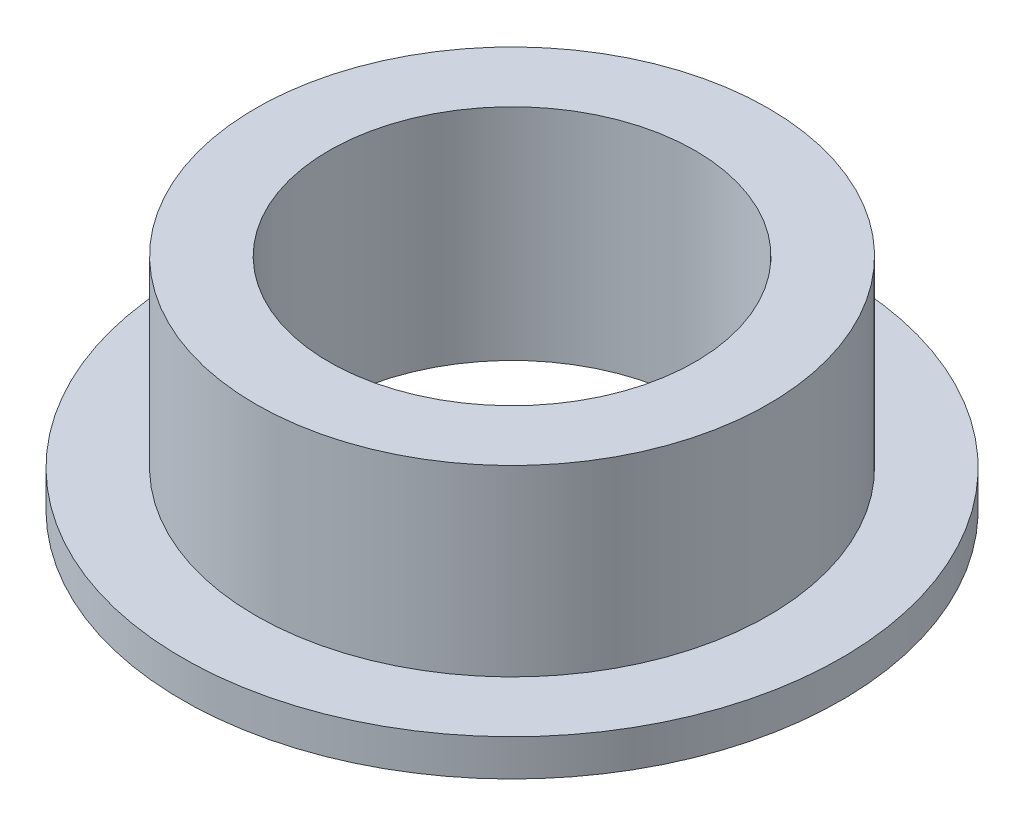
from build123d import *

# Parameters (mm, degrees)
SKETCH1_R           = 11.1125
SKETCH1_R_2         = 7.9375
BOSS_EXTRUDE1_DEPTH = 4.7625
BOSS_EXTRUDE2_START = -1.5875
SKETCH2_R           = 14.2875
SKETCH2_R_2         = 11.1125
BOSS_EXTRUDE2_DEPTH = 1.5875


with BuildPart() as part:
    # Sketch1 → Boss-Extrude1 (new, symmetric)
    with BuildSketch(Plane(origin=(0, 0, 0), x_dir=(1, 0, 0), z_dir=(0, 1, 0))):
        Circle(SKETCH1_R)
        Circle(SKETCH1_R_2, mode=Mode.SUBTRACT)
    extrude(amount=BOSS_EXTRUDE1_DEPTH, both=True)

    # Sketch2 → Boss-Extrude2 (add)
    with BuildSketch(Plane.XZ.offset(4.7625).offset(BOSS_EXTRUDE2_START)):
        Circle(SKETCH2_R)
        Circle(SKETCH2_R_2, mode=Mode.SUBTRACT)
    extrude(amount=BOSS_EXTRUDE2_DEPTH)


solid = part.part
